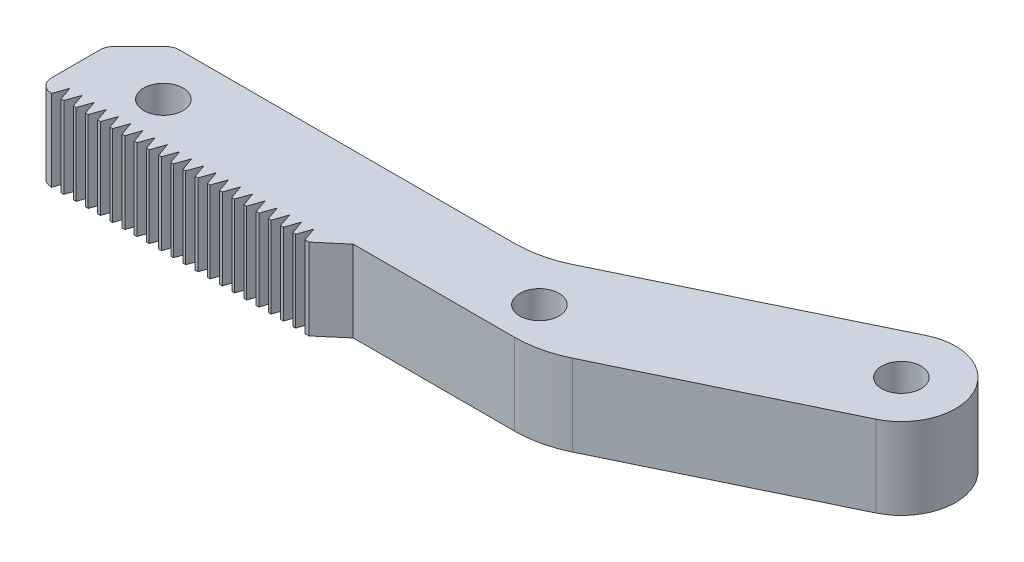
from build123d import *

# Parameters (mm, degrees)
CROQUIS_BASE_R          = 1.45
SALIENTE_EXTRUIR1_DEPTH = 6
REDONDEO1_R             = 1
REDONDEO2_R             = 8


with BuildPart() as part:
    # Croquis base → Saliente-Extruir1 (new body)
    with BuildSketch(Plane(origin=(0, 0, 0), x_dir=(1, 0, 0), z_dir=(0, 1, 0))):
        with BuildLine():
            Line((2.984067851, -3), (-10.738, -3))
            Line((-10.738, -3), (-12.5, -4.5))
            Line((-12.5, -4.5), (-12.6, -4.5))
            Line((-12.6, -4.5), (-12.8, -4.5))
            Line((-12.8, -4.5), (-13.15, -3.5))
            Line((-13.15, -3.5), (-13.5, -4.5))
            Line((-13.5, -4.5), (-13.7, -4.5))
            Line((-13.7, -4.5), (-14.05, -3.5))
            Line((-14.05, -3.5), (-14.4, -4.5))
            Line((-14.4, -4.5), (-14.6, -4.5))
            Line((-14.6, -4.5), (-14.95, -3.5))
            Line((-14.95, -3.5), (-15.3, -4.5))
            Line((-15.3, -4.5), (-15.5, -4.5))
            Line((-15.5, -4.5), (-15.85, -3.5))
            Line((-15.85, -3.5), (-16.2, -4.5))
            Line((-16.2, -4.5), (-16.4, -4.5))
            Line((-16.4, -4.5), (-16.75, -3.5))
            Line((-16.75, -3.5), (-17.1, -4.5))
            Line((-17.1, -4.5), (-17.3, -4.5))
            Line((-17.3, -4.5), (-17.65, -3.5))
            Line((-17.65, -3.5), (-18, -4.5))
            Line((-18, -4.5), (-18.2, -4.5))
            Line((-18.2, -4.5), (-18.55, -3.5))
            Line((-18.55, -3.5), (-18.9, -4.5))
            Line((-18.9, -4.5), (-19.1, -4.5))
            Line((-19.1, -4.5), (-19.45, -3.5))
            Line((-19.45, -3.5), (-19.8, -4.5))
            Line((-19.8, -4.5), (-20, -4.5))
            Line((-20, -4.5), (-20.35, -3.5))
            Line((-20.35, -3.5), (-20.7, -4.5))
            Line((-20.7, -4.5), (-20.9, -4.5))
            Line((-20.9, -4.5), (-21.25, -3.5))
            Line((-21.25, -3.5), (-21.6, -4.5))
            Line((-21.6, -4.5), (-21.8, -4.5))
            Line((-21.8, -4.5), (-22.15, -3.5))
            Line((-22.15, -3.5), (-22.5, -4.5))
            Line((-22.5, -4.5), (-22.7, -4.5))
            Line((-22.7, -4.5), (-23.05, -3.5))
            Line((-23.05, -3.5), (-23.4, -4.5))
            Line((-23.4, -4.5), (-23.6, -4.5))
            Line((-23.6, -4.5), (-23.95, -3.5))
            Line((-23.95, -3.5), (-24.3, -4.5))
            Line((-24.3, -4.5), (-24.5, -4.5))
            Line((-24.5, -4.5), (-24.85, -3.5))
            Line((-24.85, -3.5), (-25.2, -4.5))
            Line((-25.2, -4.5), (-25.4, -4.5))
            Line((-25.4, -4.5), (-25.75, -3.5))
            Line((-25.75, -3.5), (-26.1, -4.5))
            Line((-26.1, -4.5), (-26.3, -4.5))
            Line((-26.3, -4.5), (-26.65, -3.5))
            Line((-26.65, -3.5), (-27, -4.5))
            Line((-27, -4.5), (-27.2, -4.5))
            Line((-27.2, -4.5), (-27.55, -3.5))
            Line((-27.55, -3.5), (-27.9, -4.5))
            Line((-27.9, -4.5), (-28.1, -4.5))
            Line((-28.1, -4.5), (-28.45, -3.5))
            Line((-28.45, -3.5), (-28.8, -4.5))
            Line((-28.8, -4.5), (-29, -4.5))
            Line((-29, -4.5), (-29.35, -3.5))
            Line((-29.35, -3.5), (-29.7, -4.5))
            Line((-29.7, -4.5), (-29.9, -4.5))
            Line((-29.9, -4.5), (-30.25, -3.5))
            Line((-30.25, -3.5), (-30.6, -4.5))
            Line((-30.6, -4.5), (-30.8, -4.5))
            Line((-30.8, -4.5), (-31.15, -3.5))
            Line((-31.15, -3.5), (-31.5, -4.5))
            Line((-31.5, -4.5), (-32.5, -4.5))
            Line((-32.5, -4.5), (-32.5, -3))
            Line((-32.5, -3), (-32.5, 0.5))
            Line((-32.5, 0.5), (-30, 3))
            Line((-30, 3), (-2.984067851, 3))
            Line((-2.984067851, 3), (16.262914155, 12.309249498))
            ThreePointArc((16.262914155, 12.309249498), (21.605496986, 10.45), (19.746247488, 5.107417169))
            Line((19.746247488, 5.107417169), (2.984067851, -3))
        make_face()
        with Locations(Location((-27, -0.750184615, 0), (0, 0, 270))):
            Circle(CROQUIS_BASE_R, mode=Mode.SUBTRACT)
        with Locations(Location((0, 0, 0), (0, 0, 270))):
            Circle(CROQUIS_BASE_R, mode=Mode.SUBTRACT)
        with Locations(Location((18.004580821, 8.708333333, 0), (0, 0, 270))):
            Circle(CROQUIS_BASE_R, mode=Mode.SUBTRACT)
    extrude(amount=SALIENTE_EXTRUIR1_DEPTH)

    # Redondeo1
    redondeo1_edges = [part.edges().sort_by_distance(p)[0] for p in [
        (-30, 3, -3),
        (-32.5, 3, -0.5),
        (-32.5, 3, 4.5),
    ]]
    fillet(redondeo1_edges, radius=REDONDEO1_R - 0.0001)  # a hair under: the kernel refuses the full size

    # Redondeo2
    redondeo2_edges = [part.edges().sort_by_distance(p)[0] for p in [
        (2.984067851, 3, 3),
        (-2.984067851, 3, -3),
    ]]
    fillet(redondeo2_edges, radius=REDONDEO2_R)


solid = part.part
